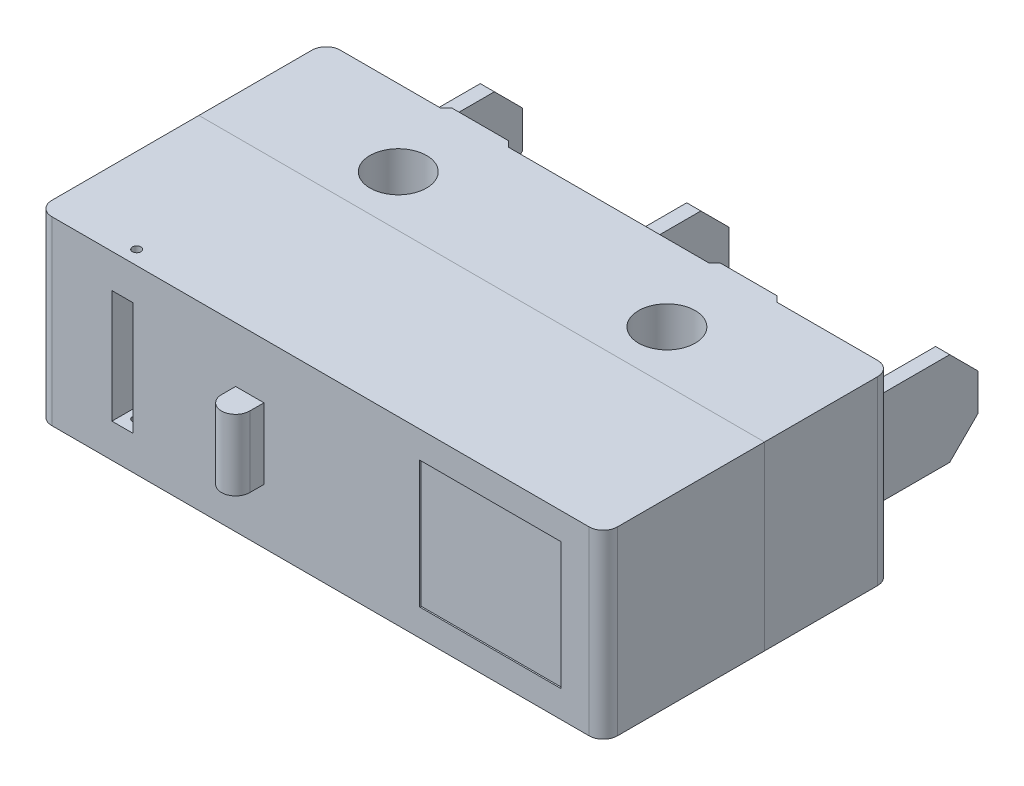
from build123d import *

# Parameters (mm, degrees)
BASE_SKETCH_W               = 20
BASE_SKETCH_H               = 6.4
BASE_EXTRUDE_DEPTH          = 4.5
CONTACTS_SKETCH_W           = 0.5
CONTACTS_SKETCH_H           = 3.3
CONTACTS_EXTRUDE_DEPTH      = 4
CONTACTS_EXTRUDE_2_DEPTH    = 4
CONTACTS_EXTRUDE_3_DEPTH    = 4
CONTACT_1_CHAMFER_SIZE      = 1
CHAMFER1_SIZE               = 1
CHAMFER2_SIZE               = 1
MOUNTING_HOLES_SKETCH_R     = 1
CUT_MOUNTING_HOLES_DEPTH    = 6.4
BOTTOM_PROTRUSIONS_SKETCH_W = 2
BOTTOM_PROTRUSIONS_SKETCH_H = 0.2
BOTTOM_PROTRUSIONS_DEPTH    = 6.4
CHAMFER_PROTRUSIONS_SIZE    = 0.2
TOP_SKETCH_W                = 20.0002
TOP_SKETCH_H                = 6.4002
TOP_EXTRUDE_DEPTH           = 5.7
BUTTON_SKETCH_W             = 1
BUTTON_SKETCH_H             = 2.5
BUTTON_EXTRUDE_DEPTH        = 1
BUTTON_FILLET_RADIUS        = 0.5
BUTTON_FILLET_LENGTH        = 2.5
TOP_INDENT_SKETCH_W         = 5
TOP_INDENT_SKETCH_H         = 4.5
TOP_INDENT_CUT_DEPTH        = 0.05
PIVOT_HOLE_SKETCH_R         = 0.15
LEVER_PIVOT_HOLE_CUT_DEPTH  = 10
LEVER_RECESS_SKETCH_W       = 0.75
LEVER_RECESS_SKETCH_H       = 4
LEVER_RECESS_CUT_DEPTH      = 1.2
CORNER_FILLET_R             = 0.5


with BuildPart() as part:
    # Base Sketch → Base Extrude (new body)
    with BuildSketch(Plane.XY):
        Rectangle(BASE_SKETCH_W, BASE_SKETCH_H)
    extrude(amount=BASE_EXTRUDE_DEPTH)

    # Mounting Holes Sketch → Cut Mounting Holes (cut)
    with BuildSketch(Plane(origin=(0, 3.2, 0), x_dir=(1, 0, 0), z_dir=(0, 1, 0))):
        with Locations(Location((-4.75, -2.7, 0), (0, 0, 270))):
            Circle(MOUNTING_HOLES_SKETCH_R)
        with Locations(Location((4.75, -2.7, 0), (0, 0, 270))):
            Circle(MOUNTING_HOLES_SKETCH_R)
    extrude(amount=-CUT_MOUNTING_HOLES_DEPTH, mode=Mode.SUBTRACT)

    # Bottom Protrusions Sketch → Bottom Protrusions (add)
    with BuildSketch(Plane(origin=(0, 3.2, 0), x_dir=(1, 0, 0), z_dir=(0, 1, 0))):
        with Locations((-4.75, 0.1)):
            Rectangle(BOTTOM_PROTRUSIONS_SKETCH_W, BOTTOM_PROTRUSIONS_SKETCH_H)
        with Locations((4.75, 0.1)):
            Rectangle(BOTTOM_PROTRUSIONS_SKETCH_W, BOTTOM_PROTRUSIONS_SKETCH_H)
    extrude(amount=-BOTTOM_PROTRUSIONS_DEPTH)

    # Chamfer Protrusions
    chamfer_protrusions_edges = [part.edges().sort_by_distance(p)[0] for p in [
        (5.75, 0, 0),
        (3.75, 0, 0),
        (-3.75, 0, 0),
        (-5.75, 0, 0),
    ]]
    chamfer(chamfer_protrusions_edges, length=CHAMFER_PROTRUSIONS_SIZE - 0.0001)  # a hair under: the kernel refuses the full size

    # Top Sketch → Top Extrude (add)
    with BuildSketch(Plane.XY.offset(4.5)):
        Rectangle(TOP_SKETCH_W, TOP_SKETCH_H)
    extrude(amount=TOP_EXTRUDE_DEPTH)

    # Top Indent Sketch → Top Indent Cut (cut)
    with BuildSketch(Plane.XY.offset(10.2)):
        with Locations((6.0001, 0)):
            Rectangle(TOP_INDENT_SKETCH_W, TOP_INDENT_SKETCH_H)
    extrude(amount=-TOP_INDENT_CUT_DEPTH, mode=Mode.SUBTRACT)

    # Pivot Hole Sketch → Lever Pivot Hole Cut (cut)
    with BuildSketch(Plane(origin=(0, 3.2001, 0), x_dir=(1, 0, 0), z_dir=(0, 1, 0))):
        with Locations(Location((-7.000095614, -9.7, 0), (0, 0, 270))):
            Circle(PIVOT_HOLE_SKETCH_R)
    extrude(amount=-LEVER_PIVOT_HOLE_CUT_DEPTH, mode=Mode.SUBTRACT)

    # Lever Recess Sketch → Lever Recess Cut (cut)
    with BuildSketch(Plane.XY.offset(10.2)):
        with Locations((-7.0001, 0)):
            Rectangle(LEVER_RECESS_SKETCH_W, LEVER_RECESS_SKETCH_H)
    extrude(amount=-LEVER_RECESS_CUT_DEPTH, mode=Mode.SUBTRACT)

    # Corner Fillet
    corner_fillet_edges = [part.edges().sort_by_distance(p)[0] for p in [
        (10.0001, 0, 10.2),
        (-10.0001, 0, 10.2),
        (-10, 0, 0),
        (10, 0, 0),
    ]]
    fillet(corner_fillet_edges, radius=CORNER_FILLET_R)


with BuildPart() as body_2:
    # Contacts Sketch → Contacts Extrude (new body)
    with BuildSketch(Plane(origin=(0, 0, 0), x_dir=(-1, 0, 0), z_dir=(0, 0, -1))):
        Rectangle(CONTACTS_SKETCH_W, CONTACTS_SKETCH_H)
    extrude(amount=CONTACTS_EXTRUDE_DEPTH)

    # Chamfer1
    chamfer1_edges = [body_2.edges().sort_by_distance(p)[0] for p in [
        (0, -1.65, -4),
        (0, 1.65, -4),
    ]]
    chamfer(chamfer1_edges, length=CHAMFER1_SIZE)


with BuildPart() as body_3:
    # Contacts Sketch → Contacts Extrude 2 (new body)
    with BuildSketch(Plane(origin=(0, 0, 0), x_dir=(-1, 0, 0), z_dir=(0, 0, -1))):
        with Locations((-8.8, 0)):
            Rectangle(CONTACTS_SKETCH_W, CONTACTS_SKETCH_H)
    extrude(amount=CONTACTS_EXTRUDE_2_DEPTH)

    # Chamfer2
    chamfer2_edges = [body_3.edges().sort_by_distance(p)[0] for p in [
        (8.8, -1.65, -4),
        (8.8, 1.65, -4),
    ]]
    chamfer(chamfer2_edges, length=CHAMFER2_SIZE)


with BuildPart() as body_4:
    # Contacts Sketch → Contacts Extrude 3 (new body)
    with BuildSketch(Plane(origin=(0, 0, 0), x_dir=(-1, 0, 0), z_dir=(0, 0, -1))):
        with Locations((7.3, 0)):
            Rectangle(CONTACTS_SKETCH_W, CONTACTS_SKETCH_H)
    extrude(amount=CONTACTS_EXTRUDE_3_DEPTH)

    # Contact 1 Chamfer
    contact_1_chamfer_edges = [body_4.edges().sort_by_distance(p)[0] for p in [
        (-7.3, -1.65, -4),
        (-7.3, 1.65, -4),
    ]]
    chamfer(contact_1_chamfer_edges, length=CONTACT_1_CHAMFER_SIZE)


with BuildPart() as body_5:
    # Button Sketch → Button Extrude (new body)
    with BuildSketch(Plane.XY.offset(10.2)):
        with Locations((-2.5001, 0)):
            Rectangle(BUTTON_SKETCH_W, BUTTON_SKETCH_H)
    extrude(amount=BUTTON_EXTRUDE_DEPTH)

    # Button Fillet: full round fillet: the end face becomes a half cylinder, R = half its width
    button_fillet_face = Plane((-2.5001, 0, 11.2), x_dir=(0, 1, 0), z_dir=(0, 0, 1))  # on the end face: x along it, z out of the body
    button_fillet_slab = button_fillet_face.offset(-BUTTON_FILLET_RADIUS / 2) * Box(BUTTON_FILLET_LENGTH, 2 * BUTTON_FILLET_RADIUS, BUTTON_FILLET_RADIUS, mode=Mode.PRIVATE)  # the body's end, R deep
    button_fillet_round = Plane((-2.5001, 0, 10.7), x_dir=(0, 0, 1), z_dir=(0, 1, 0)) * Cylinder(BUTTON_FILLET_RADIUS, BUTTON_FILLET_LENGTH, mode=Mode.PRIVATE)  # its axis R under the face
    add(button_fillet_slab - button_fillet_round, mode=Mode.SUBTRACT)


solid = Compound([part.part, body_2.part, body_3.part, body_4.part, body_5.part])
